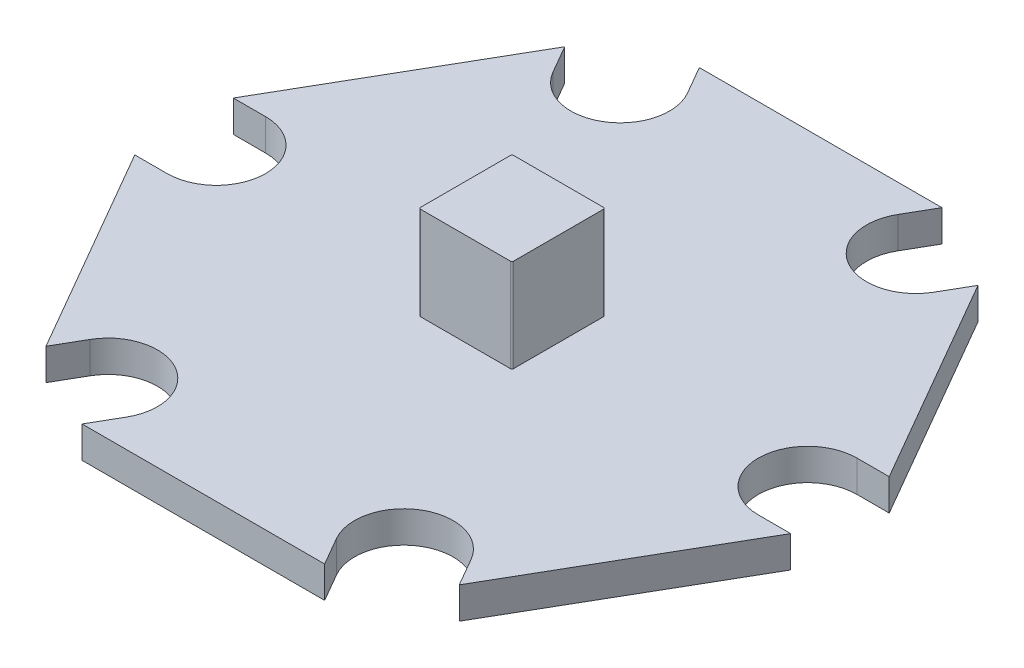
from build123d import *

# Parameters (mm, degrees)
BOSS_EXTRUDE1_DEPTH = 1.016
CUT_EXTRUDE1_DEPTH  = 1.016
CIRPATTERN1_COUNT   = 6
SKETCH3_W           = 3
SKETCH3_H           = 3
BOSS_EXTRUDE2_DEPTH = 3
FILLET1_R           = 0.0508
FILLET2_R           = 0.0508
FILLET3_R           = 0.0508
FILLET4_R           = 0.0508


with BuildPart() as part:
    # Sketch1 → Boss-Extrude1 (new body)
    with BuildSketch(Plane(origin=(0, 0, 0), x_dir=(1, 0, 0), z_dir=(0, 1, 0))):
        Polygon((5.741228812, 9.9441), (-5.741228812, 9.9441), (-11.482457624, 0), (-5.741228812, -9.9441), (5.741228812, -9.9441), (11.482457624, 0), align=None)
    extrude(amount=BOSS_EXTRUDE1_DEPTH)

    # Sketch2 → Cut-Extrude1 (cut)
    with BuildSketch(Plane(origin=(0, 1.016, 0), x_dir=(1, 0, 0), z_dir=(0, 1, 0))):
        with BuildLine():
            Line((9.525, 1.5875), (13.137780832, 1.5875))
            Line((13.137780832, 1.5875), (13.137780832, -1.5875))
            Line((13.137780832, -1.5875), (9.525, -1.5875))
            ThreePointArc((9.525, -1.5875), (7.9375, 0), (9.525, 1.5875))
        make_face()
    cut_extrude1 = extrude(amount=-CUT_EXTRUDE1_DEPTH, mode=Mode.SUBTRACT)

    # CirPattern1: Cut-Extrude1 ×6 about axis
    cirpattern1_axis = Axis((0, 4.2168, 0), (0, -1, 0))
    for i in range(1, CIRPATTERN1_COUNT):
        add(cut_extrude1.rotate(cirpattern1_axis, i * 360 / CIRPATTERN1_COUNT), mode=Mode.SUBTRACT)

    # Sketch3 → Boss-Extrude2 (add)
    with BuildSketch(Plane(origin=(0, 1.016, 0), x_dir=(1, 0, 0), z_dir=(0, 1, 0))):
        Rectangle(SKETCH3_W, SKETCH3_H)
    extrude(amount=BOSS_EXTRUDE2_DEPTH)

    # Fillet1
    fillet1_edges = [part.edges().sort_by_distance(p)[0] for p in [
        (1.5, 2.516, 1.5),
    ]]
    fillet(fillet1_edges, radius=FILLET1_R)

    # Fillet2
    fillet2_edges = [part.edges().sort_by_distance(p)[0] for p in [
        (-1.5, 2.516, -1.5),
    ]]
    fillet(fillet2_edges, radius=FILLET2_R)

    # Fillet3
    fillet3_edges = [part.edges().sort_by_distance(p)[0] for p in [
        (1.5, 2.516, -1.5),
    ]]
    fillet(fillet3_edges, radius=FILLET3_R)

    # Fillet4
    fillet4_edges = [part.edges().sort_by_distance(p)[0] for p in [
        (-1.5, 2.516, 1.5),
    ]]
    fillet(fillet4_edges, radius=FILLET4_R)


solid = part.part
